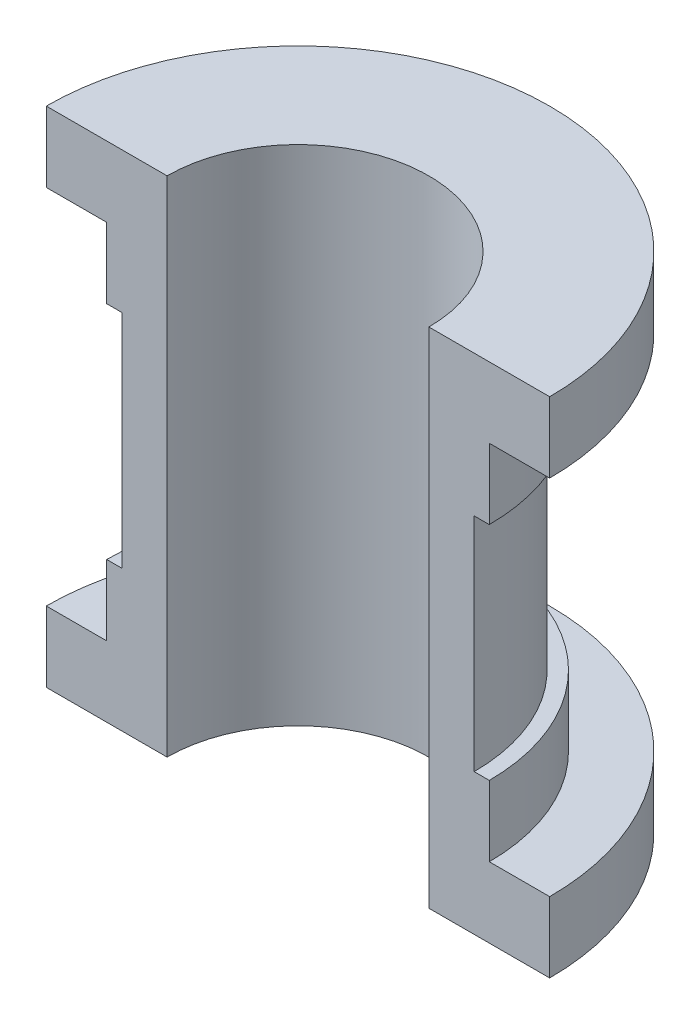
from build123d import *
from build123d.topology import SkipClean

# Parameters (mm, degrees)
BOSS_EXTRUDE2_DEPTH  = 7
BOSS_EXTRUDE3_DEPTH  = 7
BOSS_EXTRUDE4_DEPTH  = 18
SKETCH7_R            = 13
CUT_EXTRUDE3_DEPTH   = 18
BOSS_EXTRUDE7_DEPTH  = 7
BOSS_EXTRUDE9_START  = 18
BOSS_EXTRUDE9_DEPTH  = 18
BOSS_EXTRUDE10_START = 7
BOSS_EXTRUDE10_DEPTH = 7
SKETCH19_R           = 3
BOSS_EXTRUDE11_DEPTH = 5


with BuildPart() as part:
    # Sketch2 → Boss-Extrude2 (new body)
    with BuildSketch(Plane(origin=(0, 0, 0), x_dir=(1, 0, 0), z_dir=(0, 1, 0))):
        with BuildLine():
            ThreePointArc((25, 0), (0, 25), (-25, 0))
            Line((-25, 0), (-13, 0))
            ThreePointArc((-13, 0), (0, 13), (13, 0))
            Line((13, 0), (25, 0))
        make_face()
    extrude(amount=-BOSS_EXTRUDE2_DEPTH)

    # Sketch5 → Boss-Extrude3 (add)
    with BuildSketch(Plane(origin=(0, -7, 0), x_dir=(1, 0, 0), z_dir=(0, 1, 0))):
        with BuildLine():
            ThreePointArc((19, 0), (0, 19), (-19, 0))
            Line((-19, 0), (-17.5, 0))
            ThreePointArc((-17.5, 0), (0, 17.5), (17.5, 0))
            Line((17.5, 0), (19, 0))
        make_face()
    extrude(amount=-BOSS_EXTRUDE3_DEPTH)

    # Sketch6 → Boss-Extrude4 (add)
    with BuildSketch(Plane(origin=(0, -7, 0), x_dir=(1, 0, 0), z_dir=(0, 1, 0))):
        with BuildLine():
            Line((-17.5, 0), (17.5, 0))
            ThreePointArc((17.5, 0), (0, 17.5), (-17.5, 0))
        make_face()
    extrude(amount=-BOSS_EXTRUDE4_DEPTH)

    # Sketch7 → Cut-Extrude3 (cut)
    with SkipClean():  # the faces are left unmerged after this step: merging them gives an invalid solid
        with BuildSketch(Plane(origin=(0, -7, 0), x_dir=(1, 0, 0), z_dir=(0, 1, 0))):
            Circle(SKETCH7_R)
        extrude(amount=-CUT_EXTRUDE3_DEPTH, mode=Mode.SUBTRACT)
    add(part.part.scale(1), mode=Mode.REPLACE)  # the faces are merged on a copy



with BuildPart() as body_2:
    # Sketch15 → Boss-Extrude7 (new body)
    with BuildSketch(Plane(origin=(0, -50, 0), x_dir=(-1, 0, 0), z_dir=(0, -1, 0))):
        with BuildLine():
            ThreePointArc((25, 0), (0, 25), (-25, 0))
            Line((-25, 0), (-13, 0))
            ThreePointArc((-13, 0), (0, 13), (13, 0))
            Line((13, 0), (25, 0))
        make_face()
    extrude(amount=-BOSS_EXTRUDE7_DEPTH)


with BuildPart() as part_1:
    add(part.part)

    add(body_2.part)  # Boss-Extrude9 merges body 2
    # Sketch16 → Boss-Extrude9 (add)
    with BuildSketch(Plane(origin=(0, -43, 0), x_dir=(1, 0, 0), z_dir=(0, 1, 0)).offset(BOSS_EXTRUDE9_START)):
        with BuildLine():
            ThreePointArc((17.5, 0), (0, 17.5), (-17.5, 0))
            Line((-17.5, 0), (-13, 0))
            ThreePointArc((-13, 0), (0, 13), (13, 0))
            Line((13, 0), (17.5, 0))
        make_face()
    extrude(amount=-BOSS_EXTRUDE9_DEPTH)

    # Sketch18 → Boss-Extrude10 (add)
    with BuildSketch(Plane(origin=(0, -43, 0), x_dir=(1, 0, 0), z_dir=(0, 1, 0)).offset(BOSS_EXTRUDE10_START)):
        with BuildLine():
            ThreePointArc((19, 0), (0, 19), (-19, 0))
            Line((-19, 0), (-17.5, 0))
            ThreePointArc((-17.5, 0), (0, 17.5), (17.5, 0))
            Line((17.5, 0), (19, 0))
        make_face()
    extrude(amount=-BOSS_EXTRUDE10_DEPTH)


with BuildPart() as body_2_2:
    # Sketch19 → Boss-Extrude11 (new body)
    with BuildSketch(Plane.XY.offset(-17.5)):
        with Locations((0, -25)):
            Circle(SKETCH19_R)
    extrude(amount=-BOSS_EXTRUDE11_DEPTH)


solid = Compound([part_1.part, body_2_2.part])
